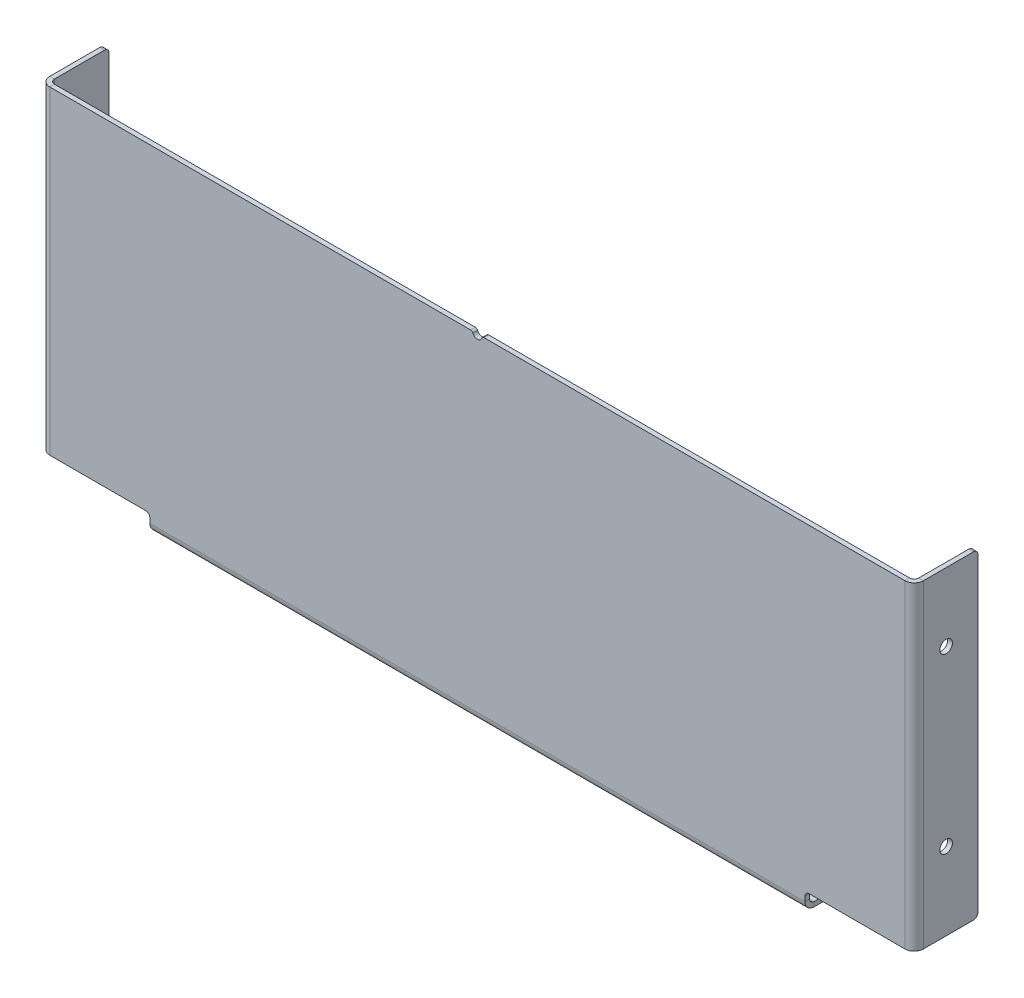
from build123d import *

# Parameters (mm, degrees)
BASE_FLANGE1_DEPTH                        = 222.25
HOLE_FOR_1_4_SELF_CLINCHING_NUTS_S_SS_C_D = 8.7376
EDGE_FLANGE1_START                        = -228.1555
EDGE_FLANGE1_DEPTH                        = 456.311
SKETCH14_R                                = 3.302
CUT_EXTRUDE2_DEPTH                        = 380.477450424
FILLET1_R                                 = 1.5875
FILLET2_R                                 = 3.175


# Read off the part's stored shape, not the designer's step: Base-Flange1, Edge-Flange1
with BuildPart() as part:
    # Base-Flange1 outline → Base-Flange1 (new body)
    with BuildSketch(Plane(origin=(0, 0, 0), x_dir=(1, 0, 0), z_dir=(0, 1, 0))):
        with BuildLine():
            Line((304.3555, 6.4389), (304.3555, 44.45))
            Line((304.3555, 44.45), (301.0916, 44.45))
            Line((301.0916, 44.45), (301.0916, 6.4389))
            ThreePointArc((301.0916, 6.4389), (300.16166403, 4.19383597), (297.9166, 3.2639))
            Line((297.9166, 3.2639), (-297.9166, 3.2639))
            ThreePointArc((-297.9166, 3.2639), (-300.16166403, 4.19383597), (-301.0916, 6.4389))
            Line((-301.0916, 6.4389), (-301.0916, 44.45))
            Line((-301.0916, 44.45), (-304.3555, 44.45))
            Line((-304.3555, 44.45), (-304.3555, 6.4389))
            ThreePointArc((-304.3555, 6.4389), (-302.469589853, 1.885910147), (-297.9166, 0))
            Line((-297.9166, 0), (297.9166, 0))
            ThreePointArc((297.9166, 0), (302.469589853, 1.885910147), (304.3555, 6.4389))
        make_face()
    extrude(amount=BASE_FLANGE1_DEPTH)

    # Hole for 1/4 Self-clinching Nuts (S,SS,CLS,CLSS)1 (through all)
    with Locations(Plane.ZY.offset(304.3555)):
        with Locations((-22.225, 174.625), (-22.225, 53.975)):
            Hole(HOLE_FOR_1_4_SELF_CLINCHING_NUTS_S_SS_C_D / 2)

    # Edge-Flange1 outline → Edge-Flange1 (add)
    with BuildSketch(Plane.YZ.offset(EDGE_FLANGE1_START)):
        with BuildLine():
            ThreePointArc((-6.2611, 0), (-10.814089853, -1.885910147), (-12.7, -6.4389))
            Line((-12.7, -6.4389), (-12.7, -31.75))
            Line((-12.7, -31.75), (-9.4361, -31.75))
            Line((-9.4361, -31.75), (-9.4361, -6.4389))
            ThreePointArc((-9.4361, -6.4389), (-8.50616403, -4.19383597), (-6.2611, -3.2639))
            Line((-6.2611, -3.2639), (0, -3.2639))
            Line((0, -3.2639), (0, 0))
            Line((0, 0), (-6.2611, 0))
        make_face()
    extrude(amount=EDGE_FLANGE1_DEPTH)

    # Sketch14 → Cut-Extrude2 (cut, through all)
    with BuildSketch(Plane.XY):
        with Locations((0, 222.25)):
            Circle(SKETCH14_R)
    extrude(amount=-CUT_EXTRUDE2_DEPTH, mode=Mode.SUBTRACT)

    # Fillet1
    fillet1_edges = [part.edges().sort_by_distance(p)[0] for p in [
        (-3.302, 222.25, -1.63195),
        (3.302, 222.25, -1.63195),
    ]]
    fillet(fillet1_edges, radius=FILLET1_R)

    # Fillet2
    fillet2_edges = [part.edges().sort_by_distance(p)[0] for p in [
        (-302.72355, 0, -44.45),
        (302.72355, 0, -44.45),
        (-302.72355, 222.25, -44.45),
        (228.1555, 0, -1.63195),
        (-228.1555, 0, -1.63195),
        (228.1555, -11.06805, -31.75),
        (-228.1555, -11.06805, -31.75),
        (302.72355, 222.25, -44.45),
    ]]
    fillet(fillet2_edges, radius=FILLET2_R)


solid = part.part
